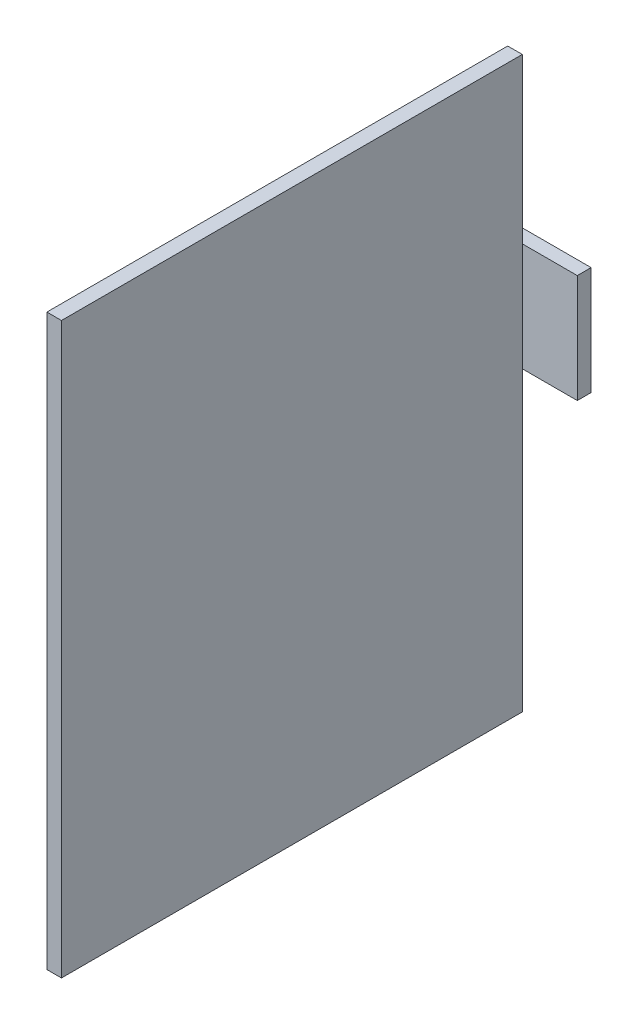
from build123d import *

# Parameters (mm, degrees)
SKETCH_2_W      = 23.702391565
SKETCH_2_H      = 23.489524234
EXTRUDE_1_DEPTH = 3
SKETCH_3_W      = 3.165508912
SKETCH_3_H      = 123.567997976
EXTRUDE_2_DEPTH = 100
FILLET_1_R      = 30


with BuildPart() as part:
    # 草图2 → 凸台-拉伸1 (new body)
    with BuildSketch(Plane.XY):
        with Locations((-21.737891338, 0.42425972)):
            Rectangle(SKETCH_2_W, SKETCH_2_H)
    extrude(amount=EXTRUDE_1_DEPTH)

    # 草图3 → 凸台-拉伸2 (add)
    with BuildSketch(Plane.XY.offset(3)):
        with Locations((-23.40524573, -14.022020715)):
            Rectangle(SKETCH_3_W, SKETCH_3_H)
    extrude(amount=EXTRUDE_2_DEPTH)

    # 圆角1
    # the kernel refuses this fillet: 30 mm, written as the material it adds along each edge
    with BuildSketch(Plane(origin=(-24.988000186, 12.169021837, 3), x_dir=(-1, 0, 0), z_dir=(0, -1, 0))) as fillet_1_piece_1:
        with BuildLine():
            CenterArc((30, -21.025853601), FILLET_1_R, 135.503813775, 44.496186225)
            Line((0, -21.025853601), (0, 0))
            Line((0, 0), (8.601086935, 0))
        make_face()
    extrude(amount=23.489524234)


solid = part.part
